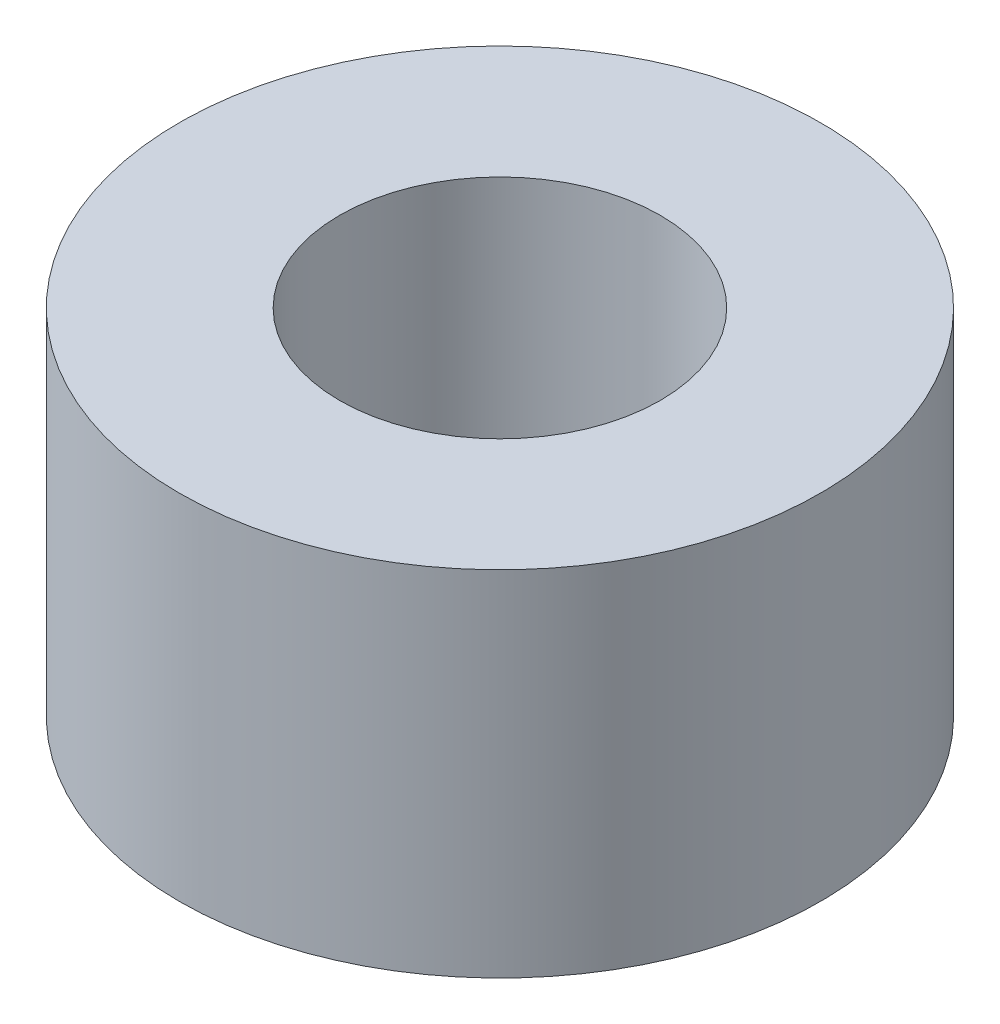
from build123d import *

# Parameters (mm, degrees)
SKETCH1_R           = 12.7
SKETCH1_R_2         = 6.35
BOSS_EXTRUDE1_DEPTH = 14


with BuildPart() as part:
    # Sketch1 → Boss-Extrude1 (new body)
    with BuildSketch(Plane(origin=(0, 0, 0), x_dir=(1, 0, 0), z_dir=(0, 1, 0))):
        Circle(SKETCH1_R)
        Circle(SKETCH1_R_2, mode=Mode.SUBTRACT)
    extrude(amount=BOSS_EXTRUDE1_DEPTH)


solid = part.part
